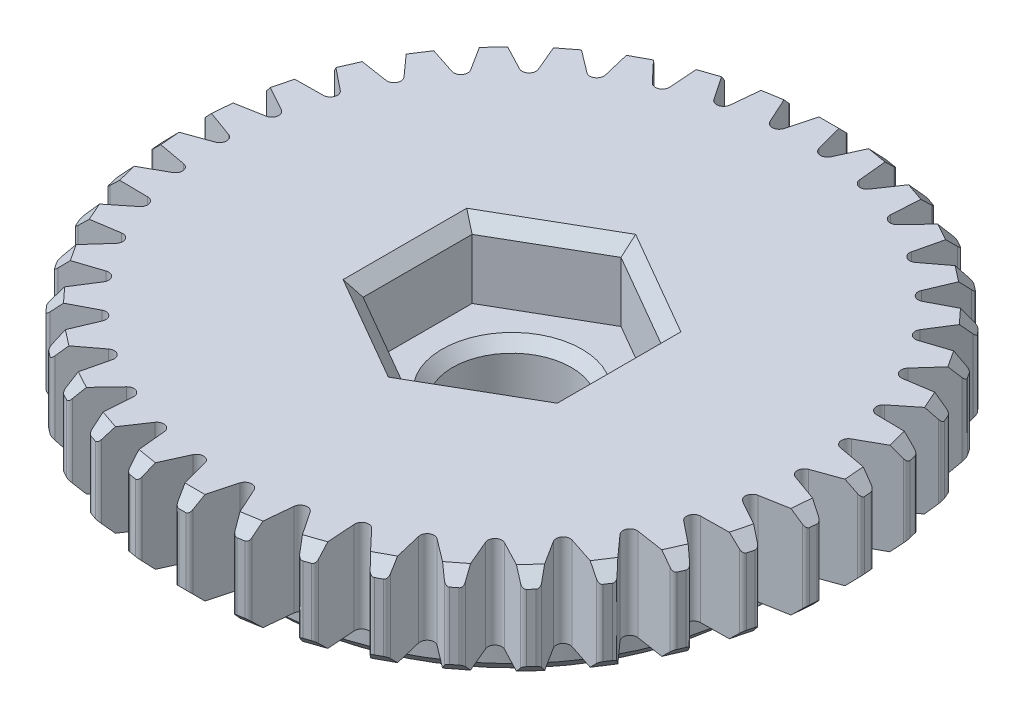
from build123d import *

# Parameters (mm, degrees)
SKETCH1_R                    = 17.4625
BOSS_EXTRUDE1_DEPTH          = 5.55625
BOSS_EXTRUDE3_DEPTH          = 5.55625
CHAMFER3_SIZE                = 0.762
FILLET3_R                    = 0.25
CIRPATTERN2_COUNT            = 38
CHAMFER3_OF_CIRPATTERN2_SIZE = 0.762
FILLET3_OF_CIRPATTERN2_R     = 0.25
SKETCH4_R                    = 0.424691146
CUT_EXTRUDE1_DEPTH           = 29.573401146
CIRPATTERN6_COUNT            = 38
SKETCH3_R                    = 15.113
BOSS_EXTRUDE4_DEPTH          = 3.175
CHAMFER1_SIZE                = 0.762
BOSS_EXTRUDE5_DEPTH          = 4.365625


with BuildPart() as part:
    # Sketch1 → Boss-Extrude1 (new body)
    with BuildSketch(Plane(origin=(0, 0, 0), x_dir=(1, 0, 0), z_dir=(0, 1, 0))):
        with Locations(Location((0, 0, 0), (0, 0, 270))):
            Circle(SKETCH1_R)
        Polygon((-5.68325, 3.281225917), (-5.68325, -3.281225917), (0, -6.562451835), (5.68325, -3.281225917), (5.68325, 3.281225917), (0, 6.562451835), align=None, mode=Mode.SUBTRACT)
    extrude(amount=BOSS_EXTRUDE1_DEPTH)

    # Sketch2 → Boss-Extrude3 (add, through all)
    with BuildSketch(Plane(origin=(0, 5.55625, 0), x_dir=(1, 0, 0), z_dir=(0, 1, 0))):
        Polygon((-0.396875, 19.84375), (0.396875, 19.84375), (1.043287197, 17.431306838), (0, 17.4625), (-1.043287197, 17.431306838), align=None)
    boss_extrude3 = extrude(amount=-BOSS_EXTRUDE3_DEPTH)

    # Chamfer3
    chamfer3_edges = [part.edges().sort_by_distance(p)[0] for p in [
        (0, 0, -19.84375),
        (0, 5.55625, -19.84375),
    ]]
    chamfer(chamfer3_edges, length=CHAMFER3_SIZE)

    # Fillet3
    fillet3_edges = [part.edges().sort_by_distance(p)[0] for p in [
        (0.396875, 2.778125, -19.84375),
        (-0.396875, 2.778125, -19.84375),
    ]]
    fillet(fillet3_edges, radius=FILLET3_R)

    # CirPattern2: Boss-Extrude3 ×38 about axis
    cirpattern2_axis = Axis((0, 0, 0), (0, 1, 0))
    for i in range(1, CIRPATTERN2_COUNT):
        add(boss_extrude3.rotate(cirpattern2_axis, i * 360 / CIRPATTERN2_COUNT))

    # Chamfer3 of CirPattern2
    chamfer3_of_cirpattern2_edges = [part.edges().sort_by_distance(p)[0] for p in [
        (-3.266173901, 0, -19.573107114),
        (-3.266173901, 5.55625, -19.573107114),
        (-6.443255092, 0, -18.76856089),
        (-6.443255092, 5.55625, -18.76856089),
        (-9.444581081, 0, -17.452057251),
        (-9.444581081, 5.55625, -17.452057251),
        (-12.188283517, 0, -15.659506983),
        (-12.188283517, 5.55625, -15.659506983),
        (-14.599521352, 0, -13.439806187),
        (-14.599521352, 5.55625, -13.439806187),
        (-16.612522303, 0, -10.853502513),
        (-16.612522303, 5.55625, -10.853502513),
        (-18.172376951, 0, -7.971143583),
        (-18.172376951, 5.55625, -7.971143583),
        (-19.236536527, 0, -4.871352635),
        (-19.236536527, 5.55625, -4.871352635),
        (-19.775973533, 0, -1.638683887),
        (-19.775973533, 5.55625, -1.638683887),
        (-19.775973533, 0, 1.638683887),
        (-19.775973533, 5.55625, 1.638683887),
        (-19.236536527, 0, 4.871352635),
        (-19.236536527, 5.55625, 4.871352635),
        (-18.172376951, 0, 7.971143583),
        (-18.172376951, 5.55625, 7.971143583),
        (-16.612522303, 0, 10.853502513),
        (-16.612522303, 5.55625, 10.853502513),
        (-14.599521352, 0, 13.439806187),
        (-14.599521352, 5.55625, 13.439806187),
        (-12.188283517, 0, 15.659506983),
        (-12.188283517, 5.55625, 15.659506983),
        (-9.444581081, 0, 17.452057251),
        (-9.444581081, 5.55625, 17.452057251),
        (-6.443255092, 0, 18.76856089),
        (-6.443255092, 5.55625, 18.76856089),
        (-3.266173901, 0, 19.573107114),
        (-3.266173901, 5.55625, 19.573107114),
        (0, 0, 19.84375),
        (0, 5.55625, 19.84375),
        (3.266173901, 0, 19.573107114),
        (3.266173901, 5.55625, 19.573107114),
        (6.443255092, 0, 18.76856089),
        (6.443255092, 5.55625, 18.76856089),
        (9.444581081, 0, 17.452057251),
        (9.444581081, 5.55625, 17.452057251),
        (12.188283517, 0, 15.659506983),
        (12.188283517, 5.55625, 15.659506983),
        (14.599521352, 0, 13.439806187),
        (14.599521352, 5.55625, 13.439806187),
        (16.612522303, 0, 10.853502513),
        (16.612522303, 5.55625, 10.853502513),
        (18.172376951, 0, 7.971143583),
        (18.172376951, 5.55625, 7.971143583),
        (19.236536527, 0, 4.871352635),
        (19.236536527, 5.55625, 4.871352635),
        (19.775973533, 0, 1.638683887),
        (19.775973533, 5.55625, 1.638683887),
        (19.775973533, 0, -1.638683887),
        (19.775973533, 5.55625, -1.638683887),
        (19.236536527, 0, -4.871352635),
        (19.236536527, 5.55625, -4.871352635),
        (18.172376951, 0, -7.971143583),
        (18.172376951, 5.55625, -7.971143583),
        (16.612522303, 0, -10.853502513),
        (16.612522303, 5.55625, -10.853502513),
        (14.599521352, 0, -13.439806187),
        (14.599521352, 5.55625, -13.439806187),
        (12.188283517, 0, -15.659506983),
        (12.188283517, 5.55625, -15.659506983),
        (9.444581081, 0, -17.452057251),
        (9.444581081, 5.55625, -17.452057251),
        (6.443255092, 0, -18.76856089),
        (6.443255092, 5.55625, -18.76856089),
        (3.266173901, 0, -19.573107114),
        (3.266173901, 5.55625, -19.573107114),
    ]]
    chamfer(chamfer3_of_cirpattern2_edges, length=CHAMFER3_OF_CIRPATTERN2_SIZE)

    # Fillet3 of CirPattern2
    fillet3_of_cirpattern2_edges = [part.edges().sort_by_distance(p)[0] for p in [
        (-2.874711759, 2.778125, -19.638430592),
        (-3.657636043, 2.778125, -19.507783636),
        (-6.067883874, 2.778125, -18.897425992),
        (-6.81862631, 2.778125, -18.639695788),
        (-9.095539936, 2.778125, -17.640948872),
        (-9.793622226, 2.778125, -17.263165629),
        (-11.875093378, 2.778125, -15.903272654),
        (-12.501473657, 2.778125, -15.415741313),
        (-14.330725229, 2.778125, -13.731796614),
        (-14.868317476, 2.778125, -13.14781576),
        (-16.395452253, 2.778125, -11.185752959),
        (-16.829592353, 2.778125, -10.521252067),
        (-18.012954079, 2.778125, -8.334591122),
        (-18.331799822, 2.778125, -7.607696044),
        (-19.139109475, 2.778125, -5.256083366),
        (-19.33396358, 2.778125, -4.486621905),
        (-19.743199855, 2.778125, -2.034203357),
        (-19.808747211, 2.778125, -1.243164416),
        (-19.808747211, 2.778125, 1.243164416),
        (-19.743199855, 2.778125, 2.034203357),
        (-19.33396358, 2.778125, 4.486621905),
        (-19.139109475, 2.778125, 5.256083366),
        (-18.331799822, 2.778125, 7.607696044),
        (-18.012954079, 2.778125, 8.334591122),
        (-16.829592353, 2.778125, 10.521252067),
        (-16.395452253, 2.778125, 11.185752959),
        (-14.868317476, 2.778125, 13.14781576),
        (-14.330725229, 2.778125, 13.731796614),
        (-12.501473657, 2.778125, 15.415741313),
        (-11.875093378, 2.778125, 15.903272654),
        (-9.793622226, 2.778125, 17.263165629),
        (-9.095539936, 2.778125, 17.640948872),
        (-6.81862631, 2.778125, 18.639695788),
        (-6.067883874, 2.778125, 18.897425992),
        (-3.657636043, 2.778125, 19.507783636),
        (-2.874711759, 2.778125, 19.638430592),
        (-0.396875, 2.778125, 19.84375),
        (0.396875, 2.778125, 19.84375),
        (2.874711759, 2.778125, 19.638430592),
        (3.657636043, 2.778125, 19.507783636),
        (6.067883874, 2.778125, 18.897425992),
        (6.81862631, 2.778125, 18.639695788),
        (9.095539936, 2.778125, 17.640948872),
        (9.793622226, 2.778125, 17.263165629),
        (11.875093378, 2.778125, 15.903272654),
        (12.501473657, 2.778125, 15.415741313),
        (14.330725229, 2.778125, 13.731796614),
        (14.868317476, 2.778125, 13.14781576),
        (16.395452253, 2.778125, 11.185752959),
        (16.829592353, 2.778125, 10.521252067),
        (18.012954079, 2.778125, 8.334591122),
        (18.331799822, 2.778125, 7.607696044),
        (19.139109475, 2.778125, 5.256083366),
        (19.33396358, 2.778125, 4.486621905),
        (19.743199855, 2.778125, 2.034203357),
        (19.808747211, 2.778125, 1.243164416),
        (19.808747211, 2.778125, -1.243164416),
        (19.743199855, 2.778125, -2.034203357),
        (19.33396358, 2.778125, -4.486621905),
        (19.139109475, 2.778125, -5.256083366),
        (18.331799822, 2.778125, -7.607696044),
        (18.012954079, 2.778125, -8.334591122),
        (16.829592353, 2.778125, -10.521252067),
        (16.395452253, 2.778125, -11.185752959),
        (14.868317476, 2.778125, -13.14781576),
        (14.330725229, 2.778125, -13.731796614),
        (12.501473657, 2.778125, -15.415741313),
        (11.875093378, 2.778125, -15.903272654),
        (9.793622226, 2.778125, -17.263165629),
        (9.095539936, 2.778125, -17.640948872),
        (6.81862631, 2.778125, -18.639695788),
        (6.067883874, 2.778125, -18.897425992),
        (3.657636043, 2.778125, -19.507783636),
        (2.874711759, 2.778125, -19.638430592),
    ]]
    fillet(fillet3_of_cirpattern2_edges, radius=FILLET3_OF_CIRPATTERN2_R)

    # Sketch4 → Cut-Extrude1 (cut, through all)
    with BuildSketch(Plane(origin=(0, 5.55625, 0), x_dir=(1, 0, 0), z_dir=(0, 1, 0))):
        with Locations((1.453507343, 17.541224995)):
            Circle(SKETCH4_R)
    cut_extrude1 = extrude(amount=-CUT_EXTRUDE1_DEPTH, mode=Mode.SUBTRACT)

    # CirPattern6: Cut-Extrude1 ×38 about axis
    cirpattern6_axis = Axis((0, 0, 0), (0, 1, 0))
    for i in range(1, CIRPATTERN6_COUNT):
        add(cut_extrude1.rotate(cirpattern6_axis, i * 360 / CIRPATTERN6_COUNT), mode=Mode.SUBTRACT)

    # Sketch3 → Boss-Extrude4 (add)
    with BuildSketch(Plane.XZ):
        with Locations(Location((0, 0, 0), (0, 0, 90))):
            Circle(SKETCH3_R)
        Polygon((-5.68325, -3.281225917), (0, -6.562451835), (5.68325, -3.281225917), (5.68325, 3.281225917), (0, 6.562451835), (-5.68325, 3.281225917), align=None, mode=Mode.SUBTRACT)
    extrude(amount=BOSS_EXTRUDE4_DEPTH)

    # Chamfer1
    chamfer1_edges = [part.edges().sort_by_distance(p)[0] for p in [
        (-2.841625, 5.55625, -4.921838876),
        (-5.68325, 5.55625, 0),
        (-2.841625, 5.55625, 4.921838876),
        (2.841625, 5.55625, 4.921838876),
        (5.68325, 5.55625, 0),
        (2.841625, 5.55625, -4.921838876),
        (0, -3.175, -15.113),
    ]]
    chamfer(chamfer1_edges, length=CHAMFER1_SIZE)

    # Sketch5 → Boss-Extrude5 (add)
    with BuildSketch(Plane.XZ.offset(3.175)):
        Polygon((5.68325, -3.281225917), (5.68325, 3.281225917), (0, 6.562451835), (-5.68325, 3.281225917), (-5.68325, -3.281225917), (0, -6.562451835), align=None)
    extrude(amount=-BOSS_EXTRUDE5_DEPTH)

    # Sketch8 → 1/4 Clearance Hole1 (revolve, cut)
    with BuildSketch(Plane(origin=(0, -3.175, 0), x_dir=(0, 0, -1), z_dir=(1, 0, 0))):
        Polygon((0, 0), (0, 4.365625), (4.20624, 4.365625), (3.57124, 3.730625), (3.57124, 0.635), (4.20624, 0), align=None)
    revolve(axis=Axis((0, -9.525, 0), (0, 1, 0)), mode=Mode.SUBTRACT)


solid = part.part
